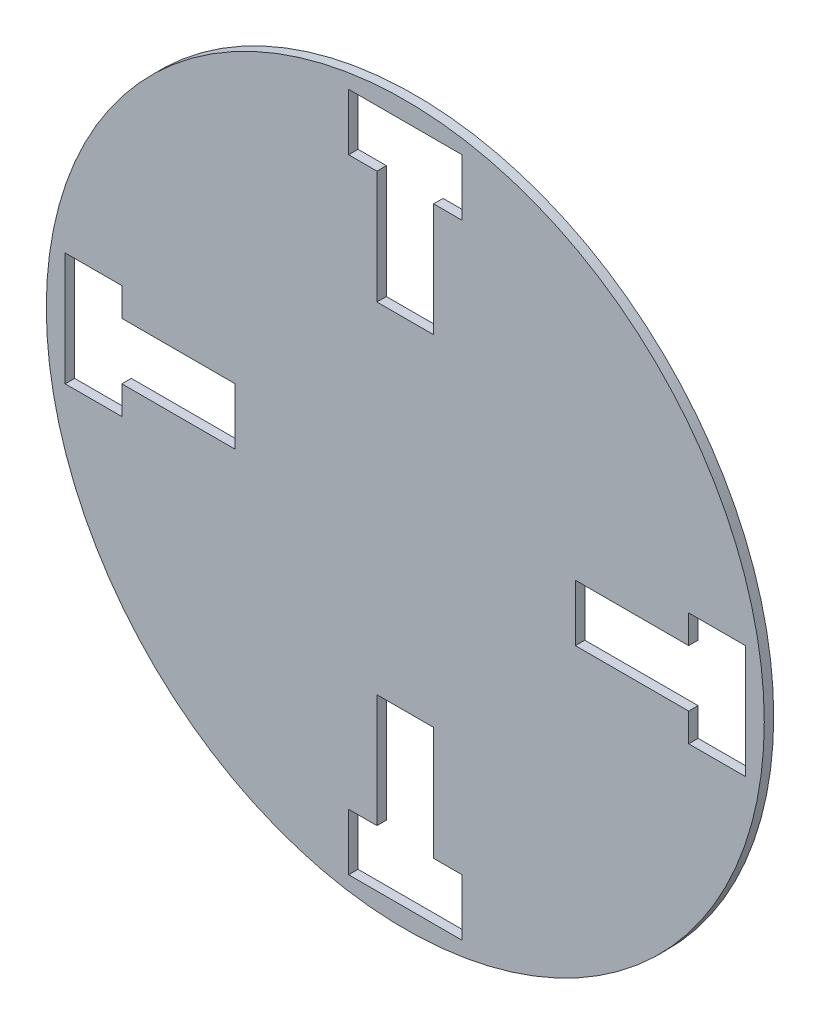
from build123d import *

# Parameters (mm, degrees)
ESQUISSE1_R             = 190
BOSS_EXTRU_1_DEPTH      = 5
ENL_V_MAT_EXTRU_1_DEPTH = 5


with BuildPart() as part:
    # Esquisse1 → Boss.-Extru.1 (new body)
    with BuildSketch(Plane.XY):
        Circle(ESQUISSE1_R)
    extrude(amount=-BOSS_EXTRU_1_DEPTH)

    # Esquisse2 → Enlèv. mat.-Extru.1 (cut)
    with BuildSketch(Plane.XY):
        Polygon((-15, 150), (-15, 90), (15, 90), (15, 150), (30, 150), (30, 180), (-30, 180), (-30, 150), align=None)
        Polygon((30, -180), (30, -150), (15, -150), (15, -90), (-15, -90), (-15, -150), (-30, -150), (-30, -180), align=None)
        Polygon((180, 30), (150, 30), (150, 15), (90, 15), (90, -15), (150, -15), (150, -30), (180, -30), align=None)
        Polygon((-180, -30), (-150, -30), (-150, -15), (-90, -15), (-90, 15), (-150, 15), (-150, 30), (-180, 30), align=None)
    extrude(amount=-ENL_V_MAT_EXTRU_1_DEPTH, mode=Mode.SUBTRACT)


solid = part.part
